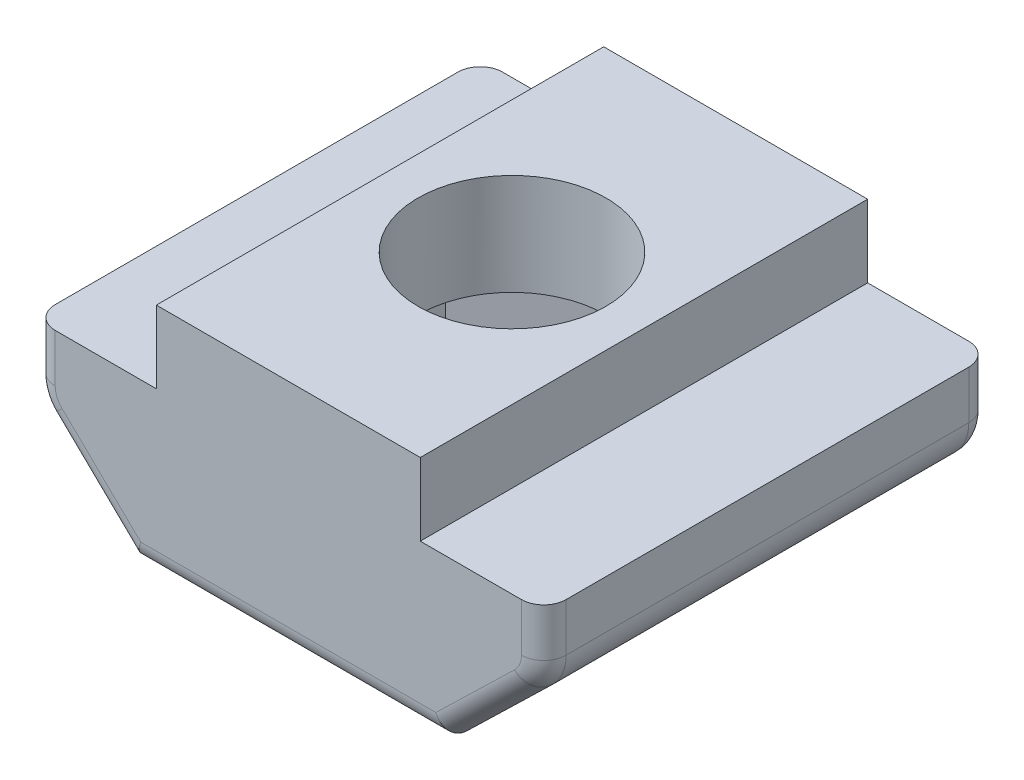
from build123d import *

# Parameters (mm, degrees)
BOSS_EXTRU_1_DEPTH      = 10
CONG_1_R                = 0.5
CONG_2_R                = 1
ESQUISSE2_R             = 2.1
ENL_V_MAT_EXTRU_1_DEPTH = 13.661149081102538
ENL_V_MAT_EXTRU_2_DEPTH = 3


with BuildPart() as part:
    # Esquisse1 → Boss.-Extru.1 (new body)
    with BuildSketch(Plane.XY):
        Polygon((-1.176e-14, 10.103135382441117), (-2.578e-14, 4.840000000000001), (3.5, 4.840000000000001), (5.71, 6.983135382441116), (5.71, 8.483135382441116), (2.95, 8.483135382441116), (2.95, 10.103135382441117), align=None)
        Polygon((-3.5, 4.840000000000001), (-2.576e-14, 4.840000000000001), (-1.176e-14, 10.103135382441117), (-2.95, 10.103135382441117), (-2.95, 8.483135382441116), (-5.71, 8.483135382441116), (-5.71, 6.983135382441116), align=None)
    extrude(amount=-BOSS_EXTRU_1_DEPTH)

    # Congé1
    cong_1_edges = [part.edges().sort_by_distance(p)[0] for p in [
        (5.71, 7.733135382441116, 0),
        (4.605, 5.911567691220558, 0),
        (0, 4.840000000000001, 0),
        (-4.605, 5.911567691220558, 0),
        (-5.71, 7.733135382441116, 0),
        (-5.71, 7.733135382441116, -10),
        (-4.605, 5.911567691220558, -10),
        (0, 4.840000000000001, -10),
        (4.605, 5.911567691220558, -10),
        (5.71, 7.733135382441116, -10),
    ]]
    fillet(cong_1_edges, radius=CONG_1_R)

    # Congé2
    # the kernel refuses this fillet: 1 mm, written as the material it takes off along each edge
    with BuildSketch(Plane(origin=(4.71, 7.4063748668930085, -10), x_dir=(1, 0, 0), z_dir=(0, 1, 0))) as cong_2_piece_1:
        with BuildLine():
            CenterArc((0.5, -0.5), 0.5, 0, 90)
            Line((1, -0.5), (1, 0))
            Line((1, 0), (0.5, 0))
        make_face()
    revolve(axis=Axis((4.71, 7.4063748668930085, -10), (0, 0, -1)), revolution_arc=45.87999999999987, mode=Mode.SUBTRACT)
    with BuildSketch(Plane(origin=(-4.710000000000001, 7.40637486689301, -10), x_dir=(-0.6961634275566162, -0.717883334625219, 0), z_dir=(0.717883334625219, -0.6961634275566162, 0))) as cong_2_piece_2:
        with BuildLine():
            CenterArc((0.5, -0.5), 0.5, 0, 90)
            Line((1, -0.5), (1, 0))
            Line((1, 0), (0.5, 0))
        make_face()
    revolve(axis=Axis((-4.710000000000001, 7.40637486689301, -10), (0, 0, -1)), revolution_arc=45.87999999999987, mode=Mode.SUBTRACT)
    with BuildSketch(Plane(origin=(4.71, 7.4063748668930085, 0), x_dir=(0.6961634275566162, -0.717883334625219, 0), z_dir=(-0.717883334625219, -0.6961634275566162, 0))) as cong_2_piece_3:
        with BuildLine():
            CenterArc((0.5, -0.5), 0.5, 0, 90)
            Line((1, -0.5), (1, 0))
            Line((1, 0), (0.5, 0))
        make_face()
    revolve(axis=Axis((4.71, 7.4063748668930085, 0), (0, 0, 1)), revolution_arc=45.87999999999987, mode=Mode.SUBTRACT)
    with BuildSketch(Plane(origin=(-4.710000000000001, 7.40637486689301, 0), x_dir=(-1, 0, 0), z_dir=(0, 1, 0))) as cong_2_piece_4:
        with BuildLine():
            CenterArc((0.5, -0.5), 0.5, 0, 90)
            Line((1, -0.5), (1, 0))
            Line((1, 0), (0.5, 0))
        make_face()
    revolve(axis=Axis((-4.710000000000001, 7.40637486689301, 0), (0, 0, 1)), revolution_arc=45.87999999999987, mode=Mode.SUBTRACT)
    with BuildSketch(Plane(origin=(-5.71, 6.983135382441116, 1.1e-16), x_dir=(0.717883334625219, -0.6961634275566161, 0), z_dir=(0, 0, -1))) as cong_2_piece_5:
        with BuildLine():
            CenterArc((CONG_2_R * 0.423239484452, -CONG_2_R), CONG_2_R, 90.00000000000003, 45.879999999999825)
            Line((-CONG_2_R * 0.294643850173, -CONG_2_R * 0.303836572443), (0, 0))
            Line((0, 0), (CONG_2_R * 0.423239484452, 0))
        make_face()
    extrude(amount=10, mode=Mode.SUBTRACT)
    with BuildSketch(Plane(origin=(5.71, 6.983135382441116, 1.1e-16), x_dir=(-0.7178833346252179, -0.6961634275566172, 0), z_dir=(0, 0, -1))) as cong_2_piece_6:
        with BuildLine():
            CenterArc((CONG_2_R * 0.423239484452, CONG_2_R), CONG_2_R, 224.12000000000015, 45.87999999999994)
            Line((-CONG_2_R * 0.294643850173, CONG_2_R * 0.303836572443), (0, 0))
            Line((0, 0), (CONG_2_R * 0.423239484452, 2e-17))
        make_face()
    extrude(amount=10, mode=Mode.SUBTRACT)

    # Esquisse2 → Enlèv. mat.-Extru.1 (cut, through all)
    with BuildSketch(Plane(origin=(0, 10.103135382441117, 0), x_dir=(1, 0, 0), z_dir=(0, 1, 0))):
        with Locations(Location((0, 5, 0), (0, 0, 270))):
            Circle(ESQUISSE2_R)
    extrude(amount=-ENL_V_MAT_EXTRU_1_DEPTH, mode=Mode.SUBTRACT)

    # Esquisse3 → Enlèv. mat.-Extru.2 (cut)
    with BuildSketch(Plane.XZ.offset(-4.840000000000001)):
        Polygon((0, -9.05), (3.5074028853269765, -7.025), (3.5074028853269774, -2.975), (5e-16, -0.9499999999999995), (-3.5074028853269774, -2.975), (-3.5074028853269774, -7.025000000000001), align=None)
    extrude(amount=-ENL_V_MAT_EXTRU_2_DEPTH, mode=Mode.SUBTRACT)


solid = part.part
